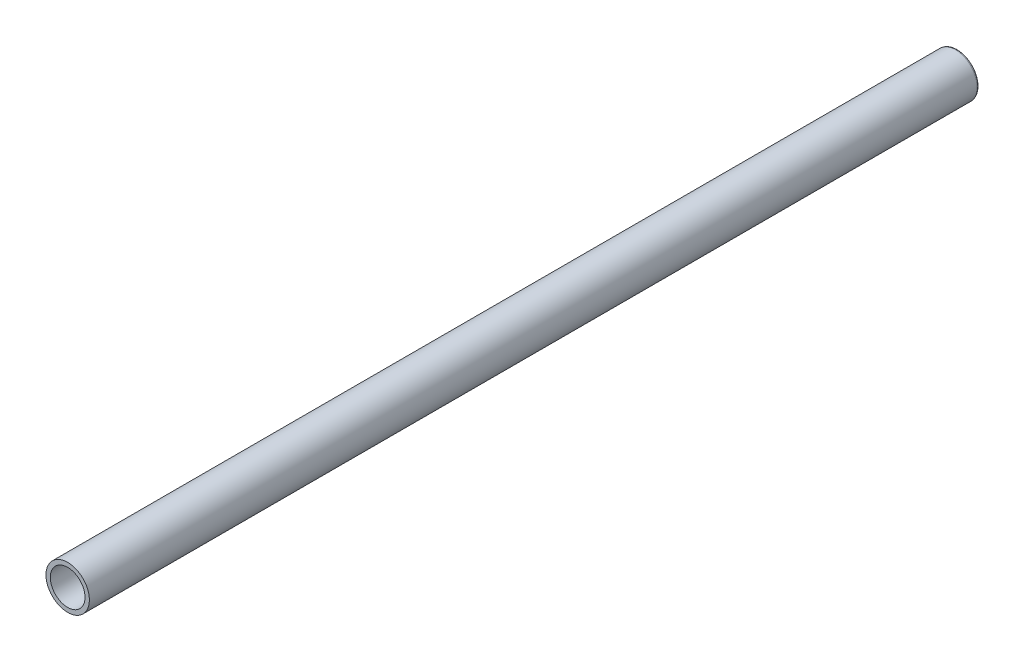
from build123d import *

# Parameters (mm, degrees)
SCHIZZO1_W               = 205
SCHIZZO1_H               = 1
SCHIZZO2_R               = 1.5
TAGLIO_ESTRUSIONE1_DEPTH = 10
SCHIZZO3_R               = 1
TAGLIO_ESTRUSIONE2_DEPTH = 10
RACCORDO4_R              = 0.5


with BuildPart() as part:
    # Schizzo1 → Rivoluzione1 (revolve)
    with BuildSketch(Plane(origin=(0, 0, 0), x_dir=(0, 0, -1), z_dir=(1, 0, 0)), mode=Mode.PRIVATE) as rivoluzione1_sk:
        with Locations((-22.156399009, 4.5)):
            Rectangle(SCHIZZO1_W, SCHIZZO1_H)
    revolve(rivoluzione1_sk.sketch.rotate(Axis((0, 0, 65.406887886), (0, 0, -1)), 90), axis=Axis((0, 0, 65.406887886), (0, 0, -1)))

    # Schizzo2 → Taglio-Estrusione1 (cut)
    with BuildSketch(Plane(origin=(0, 0, 0), x_dir=(1, 0, 0), z_dir=(0, 1, 0))):
        with Locations(Location((0, 64.343600991, 0), (0, 0, 270))):
            Circle(SCHIZZO2_R)
    extrude(amount=-TAGLIO_ESTRUSIONE1_DEPTH, mode=Mode.SUBTRACT)

    # Schizzo3 → Taglio-Estrusione2 (cut)
    with BuildSketch(Plane(origin=(0, 0, 0), x_dir=(0, 0, -1), z_dir=(1, 0, 0))):
        with Locations((65.343600991, 0)):
            Circle(SCHIZZO3_R)
    extrude(amount=-TAGLIO_ESTRUSIONE2_DEPTH, mode=Mode.SUBTRACT)

    # Raccordo4
    raccordo4_edges = [part.edges().sort_by_distance(p)[0] for p in [
        (-5, 0, -80.343600991),
        (-4, 0, -80.343600991),
    ]]
    fillet(raccordo4_edges, radius=RACCORDO4_R - 0.0001)  # a hair under: the kernel refuses the full size


solid = part.part
